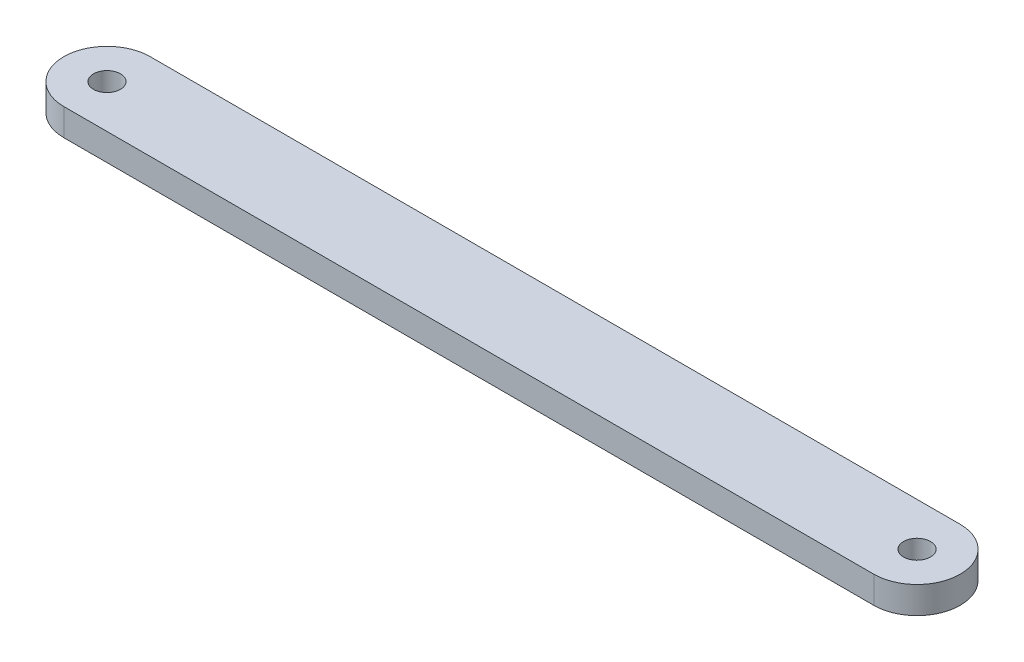
from build123d import *

# Parameters (mm, degrees)
SKETCH2_R           = 2.5
BOSS_EXTRUDE1_DEPTH = 5


with BuildPart() as part:
    # Sketch2 → Boss-Extrude1 (new body)
    with BuildSketch(Plane(origin=(0, 0, 0), x_dir=(1, 0, 0), z_dir=(0, 1, 0))):
        with BuildLine():
            Line((75, -8), (-75, -8))
            ThreePointArc((-75, -8), (-83, 0), (-75, 8))
            Line((-75, 8), (75, 8))
            ThreePointArc((75, 8), (83, 0), (75, -8))
        make_face()
        with Locations((75, 0)):
            Circle(SKETCH2_R, mode=Mode.SUBTRACT)
        with Locations((-75, 0)):
            Circle(SKETCH2_R, mode=Mode.SUBTRACT)
    extrude(amount=BOSS_EXTRUDE1_DEPTH)


solid = part.part
